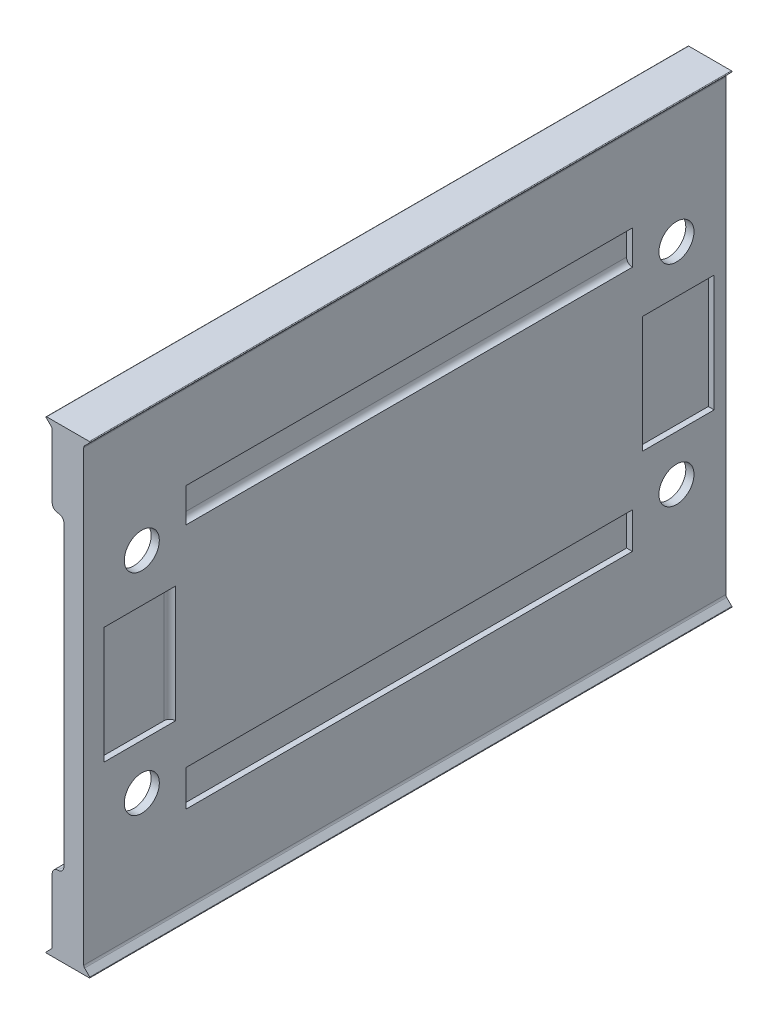
from build123d import *

# Parameters (mm, degrees)
BOSS_EXTRUDE1_DEPTH = 55
SKETCH2_R           = 2.5
SKETCH2_W           = 40
SKETCH2_H           = 18
CUT_EXTRUDE4_DEPTH  = 0.5
SKETCH7_R           = 1.5
CUT_EXTRUDE7_DEPTH  = 59.578479227
SKETCH8_R           = 3.75
CUT_EXTRUDE8_DEPTH  = 2
SKETCH9_W           = 55
SKETCH9_H           = 26.5
CUT_EXTRUDE9_DEPTH  = 1
FILLET1_R           = 0.5
FILLET2_R           = 0.5
FILLET4_R           = 0.5
FILLET5_R           = 0.5
BOSS_EXTRUDE3_START = 0.5
SKETCH10_W          = 7
SKETCH10_H          = 7
SKETCH10_R          = 1.5
BOSS_EXTRUDE3_DEPTH = 0.5


# Some blends are built 0.0001 mm under size
with BuildPart() as part:
    # Sketch1 → Boss-Extrude1 (new body)
    with BuildSketch(Plane.XY):
        with BuildLine():
            Line((-1.829289322, 19.9), (1.829289322, 19.9))
            ThreePointArc((1.829289322, 19.9), (1.875483299, 19.869134172), (1.864644661, 19.814644661))
            Line((1.864644661, 19.814644661), (1.423210766, 19.373210766))
            ThreePointArc((1.423210766, 19.373210766), (1.369017579, 19.292104929), (1.349987462, 19.196434071))
            Line((1.349987462, 19.196434071), (1.349987462, -19.196434071))
            ThreePointArc((1.349987462, -19.196434071), (1.369017579, -19.292104929), (1.423210766, -19.373210766))
            Line((1.423210766, -19.373210766), (1.864644661, -19.814644661))
            ThreePointArc((1.864644661, -19.814644661), (1.875483299, -19.869134172), (1.829289322, -19.9))
            Line((1.829289322, -19.9), (-1.829289322, -19.9))
            ThreePointArc((-1.829289322, -19.9), (-1.875483299, -19.869134172), (-1.864644661, -19.814644661))
            Line((-1.864644661, -19.814644661), (-1.423210766, -19.373210766))
            ThreePointArc((-1.423210766, -19.373210766), (-1.3697009, -19.293738232), (-1.350012538, -19.199974923))
            Line((-1.350012538, -19.199974923), (-1.350012538, 19.192893219))
            ThreePointArc((-1.350012538, 19.192893219), (-1.368345841, 19.290466829), (-1.423210766, 19.373210766))
            Line((-1.423210766, 19.373210766), (-1.864644661, 19.814644661))
            ThreePointArc((-1.864644661, 19.814644661), (-1.875483299, 19.869134172), (-1.829289322, 19.9))
        make_face()
    extrude(amount=BOSS_EXTRUDE1_DEPTH)

    # Sketch2 → Cut-Extrude4 (cut)
    with BuildSketch(Plane(origin=(1.349987462, 0, 0), x_dir=(0, 0, -1), z_dir=(1, 0, 0))):
        with BuildLine():
            Line((-51.25, 12), (-3, 12))
            ThreePointArc((-3, 12), (-1.585786438, 11.414213562), (-1, 10))
            Line((-1, 10), (-1, -10))
            ThreePointArc((-1, -10), (-1.585786438, -11.414213562), (-3, -12))
            Line((-3, -12), (-51.25, -12))
            ThreePointArc((-51.25, -12), (-52.664213562, -11.414213562), (-53.25, -10))
            Line((-53.25, -10), (-53.25, 10))
            ThreePointArc((-53.25, 10), (-52.664213562, 11.414213562), (-51.25, 12))
        make_face()
        with Locations(Location((-50.025, 9.087908505, 0), (0, 0, 90))):
            Circle(SKETCH2_R, mode=Mode.SUBTRACT)
        with Locations(Location((-50.025, -8.912091495, 0), (0, 0, 90))):
            Circle(SKETCH2_R, mode=Mode.SUBTRACT)
        with Locations(Location((-4.225, -8.912091495, 0), (0, 0, 90))):
            Circle(SKETCH2_R, mode=Mode.SUBTRACT)
        with Locations(Location((-4.225, 9.087908505, 0), (0, 0, 90))):
            Circle(SKETCH2_R, mode=Mode.SUBTRACT)
        with Locations((-27.125, 0.087908505)):
            Rectangle(SKETCH2_W, SKETCH2_H, mode=Mode.SUBTRACT)
    extrude(amount=-CUT_EXTRUDE4_DEPTH, mode=Mode.SUBTRACT)

    # Sketch7 → Cut-Extrude7 (cut, through all)
    with BuildSketch(Plane(origin=(1.349987462, 0, 0), x_dir=(0, 0, -1), z_dir=(1, 0, 0))):
        with Locations((-50.025, 9.087908505)):
            Circle(SKETCH7_R)
        with Locations((-4.225, 9.087908505)):
            Circle(SKETCH7_R)
        with Locations((-4.225, -8.912091495)):
            Circle(SKETCH7_R)
        with Locations((-50.025, -8.912091495)):
            Circle(SKETCH7_R)
    extrude(amount=-CUT_EXTRUDE7_DEPTH, mode=Mode.SUBTRACT)

    # Sketch8 → Cut-Extrude8 (cut)
    with BuildSketch(Plane.ZY.offset(1.350012538)):
        with Locations(Location((4.225, 9.087908505, 0), (0, 0, 270))):
            Circle(SKETCH8_R)
        with Locations(Location((4.225, -8.912091495, 0), (0, 0, 270))):
            Circle(SKETCH8_R)
        with Locations(Location((50.025, 9.087908505, 0), (0, 0, 270))):
            Circle(SKETCH8_R)
        with Locations(Location((50.025, -8.912091495, 0), (0, 0, 270))):
            Circle(SKETCH8_R)
    extrude(amount=-CUT_EXTRUDE8_DEPTH, mode=Mode.SUBTRACT)

    # Sketch9 → Cut-Extrude9 (cut)
    with BuildSketch(Plane.ZY.offset(1.350012538)):
        with Locations((27.5, 0)):
            Rectangle(SKETCH9_W, SKETCH9_H)
    extrude(amount=-CUT_EXTRUDE9_DEPTH, mode=Mode.SUBTRACT)

    # Fillet1
    fillet1_edges = [part.edges().sort_by_distance(p)[0] for p in [
        (-0.350012538, 13.25, 27.5),
        (-0.350012538, -13.25, 27.5),
    ]]
    fillet(fillet1_edges, radius=FILLET1_R)

    # Fillet2
    fillet2_edges = [part.edges().sort_by_distance(p)[0] for p in [
        (-1.350012538, -13.25, 27.5),
        (-1.350012538, 13.25, 27.5),
    ]]
    fillet(fillet2_edges, radius=FILLET2_R - 0.0001)  # a hair under: the kernel refuses the full size

    # Fillet4
    # the kernel refuses this fillet: 0.5 mm, written as the material it adds along each edge
    with BuildSketch(Plane(origin=(0.849987462, 9.087908505, 7.125), x_dir=(0, 0, -1), z_dir=(0, -1, 0)), Plane(origin=(0.849987462, -8.912091495, 47.125), x_dir=(0, 0, 1), z_dir=(0, 1, 0))) as fillet4_piece_1:
        with BuildLine():
            CenterArc((FILLET4_R, FILLET4_R), FILLET4_R, 180, 90)
            Line((0, FILLET4_R), (-FILLET4_R * 0.02, FILLET4_R))
            Line((-FILLET4_R * 0.02, FILLET4_R), (-FILLET4_R * 0.02, -FILLET4_R * 0.02))
            Line((-FILLET4_R * 0.02, -FILLET4_R * 0.02), (FILLET4_R, -FILLET4_R * 0.02))
            Line((FILLET4_R, -FILLET4_R * 0.02), (FILLET4_R, 0))
        make_face()
    extrude(amount=18)
    with BuildSketch(Plane(origin=(0.849987462, -8.912091495, 7.125), x_dir=(0, -1, 0), z_dir=(0, 0, 1)), Plane(origin=(0.849987462, 9.087908505, 47.125), x_dir=(0, 1, 0), z_dir=(0, 0, -1))) as fillet4_piece_2:
        with BuildLine():
            CenterArc((FILLET4_R, FILLET4_R), FILLET4_R, 180, 90)
            Line((0, FILLET4_R), (-FILLET4_R * 0.02, FILLET4_R))
            Line((-FILLET4_R * 0.02, FILLET4_R), (-FILLET4_R * 0.02, -FILLET4_R * 0.02))
            Line((-FILLET4_R * 0.02, -FILLET4_R * 0.02), (FILLET4_R, -FILLET4_R * 0.02))
            Line((FILLET4_R, -FILLET4_R * 0.02), (FILLET4_R, 0))
        make_face()
    extrude(amount=40)
    with BuildSketch(Plane(origin=(0.849987462, 10.337908505, 7.125), x_dir=(0, 0, -1), z_dir=(0, -1, 0))) as fillet4_piece_3a_section:
        with BuildLine():
            CenterArc((FILLET4_R, FILLET4_R), FILLET4_R, 180, 90)
            Line((0, FILLET4_R), (-FILLET4_R * 0.02, FILLET4_R))
            Line((-FILLET4_R * 0.02, FILLET4_R), (-FILLET4_R * 0.02, -FILLET4_R * 0.02))
            Line((-FILLET4_R * 0.02, -FILLET4_R * 0.02), (FILLET4_R, -FILLET4_R * 0.02))
            Line((FILLET4_R, -FILLET4_R * 0.02), (FILLET4_R, 0))
        make_face()
    fillet4_piece_3a = extrude(amount=19.25, mode=Mode.PRIVATE)
    fillet4_piece_3a = split(fillet4_piece_3a, bisect_by=Plane(origin=(0.963185019, 9.087908505, 7.011802443), z_dir=(0, 1, 0)), keep=Keep.TOP, mode=Mode.PRIVATE)
    with BuildSketch(Plane(origin=(0.849987462, 9.087908505, 47.125), x_dir=(0, 1, 0), z_dir=(0, 0, -1))) as fillet4_piece_3b_section:
        with BuildLine():
            CenterArc((FILLET4_R, FILLET4_R), FILLET4_R, 180, 90)
            Line((0, FILLET4_R), (-FILLET4_R * 0.02, FILLET4_R))
            Line((-FILLET4_R * 0.02, FILLET4_R), (-FILLET4_R * 0.02, -FILLET4_R * 0.02))
            Line((-FILLET4_R * 0.02, -FILLET4_R * 0.02), (FILLET4_R, -FILLET4_R * 0.02))
            Line((FILLET4_R, -FILLET4_R * 0.02), (FILLET4_R, 0))
        make_face()
    fillet4_piece_3b = extrude(amount=41.25, mode=Mode.PRIVATE)
    fillet4_piece_3b = split(fillet4_piece_3b, bisect_by=Plane(origin=(0.963185019, 9.201106062, 7.125), z_dir=(0, 0, -1)), keep=Keep.TOP, mode=Mode.PRIVATE)
    fillet4_piece_3 = fillet4_piece_3a & fillet4_piece_3b
    add(fillet4_piece_3)
    with BuildSketch(Plane(origin=(0.849987462, -8.912091495, 5.875), x_dir=(0, -1, 0), z_dir=(0, 0, 1))) as fillet4_piece_4a_section:
        with BuildLine():
            CenterArc((FILLET4_R, FILLET4_R), FILLET4_R, 180, 90)
            Line((0, FILLET4_R), (-FILLET4_R * 0.02, FILLET4_R))
            Line((-FILLET4_R * 0.02, FILLET4_R), (-FILLET4_R * 0.02, -FILLET4_R * 0.02))
            Line((-FILLET4_R * 0.02, -FILLET4_R * 0.02), (FILLET4_R, -FILLET4_R * 0.02))
            Line((FILLET4_R, -FILLET4_R * 0.02), (FILLET4_R, 0))
        make_face()
    fillet4_piece_4a = extrude(amount=41.25, mode=Mode.PRIVATE)
    fillet4_piece_4a = split(fillet4_piece_4a, bisect_by=Plane(origin=(0.963185019, -9.025289052, 7.125), z_dir=(0, 0, -1)), keep=Keep.TOP, mode=Mode.PRIVATE)
    with BuildSketch(Plane(origin=(0.849987462, 9.087908505, 7.125), x_dir=(0, 0, -1), z_dir=(0, -1, 0))) as fillet4_piece_4b_section:
        with BuildLine():
            CenterArc((FILLET4_R, FILLET4_R), FILLET4_R, 180, 90)
            Line((0, FILLET4_R), (-FILLET4_R * 0.02, FILLET4_R))
            Line((-FILLET4_R * 0.02, FILLET4_R), (-FILLET4_R * 0.02, -FILLET4_R * 0.02))
            Line((-FILLET4_R * 0.02, -FILLET4_R * 0.02), (FILLET4_R, -FILLET4_R * 0.02))
            Line((FILLET4_R, -FILLET4_R * 0.02), (FILLET4_R, 0))
        make_face()
    fillet4_piece_4b = extrude(amount=19.25, mode=Mode.PRIVATE)
    fillet4_piece_4b = split(fillet4_piece_4b, bisect_by=Plane(origin=(0.963185019, -8.912091495, 7.011802443), z_dir=(0, -1, 0)), keep=Keep.TOP, mode=Mode.PRIVATE)
    fillet4_piece_4 = fillet4_piece_4a & fillet4_piece_4b
    add(fillet4_piece_4)
    with BuildSketch(Plane(origin=(0.849987462, -10.162091495, 47.125), x_dir=(0, 0, 1), z_dir=(0, 1, 0))) as fillet4_piece_5a_section:
        with BuildLine():
            CenterArc((FILLET4_R, FILLET4_R), FILLET4_R, 180, 90)
            Line((0, FILLET4_R), (-FILLET4_R * 0.02, FILLET4_R))
            Line((-FILLET4_R * 0.02, FILLET4_R), (-FILLET4_R * 0.02, -FILLET4_R * 0.02))
            Line((-FILLET4_R * 0.02, -FILLET4_R * 0.02), (FILLET4_R, -FILLET4_R * 0.02))
            Line((FILLET4_R, -FILLET4_R * 0.02), (FILLET4_R, 0))
        make_face()
    fillet4_piece_5a = extrude(amount=19.25, mode=Mode.PRIVATE)
    fillet4_piece_5a = split(fillet4_piece_5a, bisect_by=Plane(origin=(0.963185019, -8.912091495, 47.238197557), z_dir=(0, -1, 0)), keep=Keep.TOP, mode=Mode.PRIVATE)
    with BuildSketch(Plane(origin=(0.849987462, -8.912091495, 7.125), x_dir=(0, -1, 0), z_dir=(0, 0, 1))) as fillet4_piece_5b_section:
        with BuildLine():
            CenterArc((FILLET4_R, FILLET4_R), FILLET4_R, 180, 90)
            Line((0, FILLET4_R), (-FILLET4_R * 0.02, FILLET4_R))
            Line((-FILLET4_R * 0.02, FILLET4_R), (-FILLET4_R * 0.02, -FILLET4_R * 0.02))
            Line((-FILLET4_R * 0.02, -FILLET4_R * 0.02), (FILLET4_R, -FILLET4_R * 0.02))
            Line((FILLET4_R, -FILLET4_R * 0.02), (FILLET4_R, 0))
        make_face()
    fillet4_piece_5b = extrude(amount=41.25, mode=Mode.PRIVATE)
    fillet4_piece_5b = split(fillet4_piece_5b, bisect_by=Plane(origin=(0.963185019, -9.025289052, 47.125), z_dir=(0, 0, 1)), keep=Keep.TOP, mode=Mode.PRIVATE)
    fillet4_piece_5 = fillet4_piece_5a & fillet4_piece_5b
    add(fillet4_piece_5)
    with BuildSketch(Plane(origin=(0.849987462, -8.912091495, 47.125), x_dir=(0, 0, 1), z_dir=(0, 1, 0))) as fillet4_piece_6a_section:
        with BuildLine():
            CenterArc((FILLET4_R, FILLET4_R), FILLET4_R, 180, 90)
            Line((0, FILLET4_R), (-FILLET4_R * 0.02, FILLET4_R))
            Line((-FILLET4_R * 0.02, FILLET4_R), (-FILLET4_R * 0.02, -FILLET4_R * 0.02))
            Line((-FILLET4_R * 0.02, -FILLET4_R * 0.02), (FILLET4_R, -FILLET4_R * 0.02))
            Line((FILLET4_R, -FILLET4_R * 0.02), (FILLET4_R, 0))
        make_face()
    fillet4_piece_6a = extrude(amount=19.25, mode=Mode.PRIVATE)
    fillet4_piece_6a = split(fillet4_piece_6a, bisect_by=Plane(origin=(0.963185019, 9.087908505, 47.238197557), z_dir=(0, 1, 0)), keep=Keep.TOP, mode=Mode.PRIVATE)
    with BuildSketch(Plane(origin=(0.849987462, 9.087908505, 48.375), x_dir=(0, 1, 0), z_dir=(0, 0, -1))) as fillet4_piece_6b_section:
        with BuildLine():
            CenterArc((FILLET4_R, FILLET4_R), FILLET4_R, 180, 90)
            Line((0, FILLET4_R), (-FILLET4_R * 0.02, FILLET4_R))
            Line((-FILLET4_R * 0.02, FILLET4_R), (-FILLET4_R * 0.02, -FILLET4_R * 0.02))
            Line((-FILLET4_R * 0.02, -FILLET4_R * 0.02), (FILLET4_R, -FILLET4_R * 0.02))
            Line((FILLET4_R, -FILLET4_R * 0.02), (FILLET4_R, 0))
        make_face()
    fillet4_piece_6b = extrude(amount=41.25, mode=Mode.PRIVATE)
    fillet4_piece_6b = split(fillet4_piece_6b, bisect_by=Plane(origin=(0.963185019, 9.201106062, 47.125), z_dir=(0, 0, 1)), keep=Keep.TOP, mode=Mode.PRIVATE)
    fillet4_piece_6 = fillet4_piece_6a & fillet4_piece_6b
    add(fillet4_piece_6)

    # Fillet5
    fillet5_edges = [part.edges().sort_by_distance(p)[0] for p in [
        (0.649987462, -5.162091495, 4.225),
        (0.649987462, 12.837908505, 50.025),
        (0.649987462, -5.162091495, 50.025),
        (0.649987462, 12.837908505, 4.225),
    ]]
    fillet(fillet5_edges, radius=FILLET5_R)

    # Sketch10 → Boss-Extrude3 (add)
    # profile 1 of 4: a face of its own
    with BuildSketch(Plane(origin=(0.849987462, 0, 0), x_dir=(0, 0, -1), z_dir=(1, 0, 0)).offset(BOSS_EXTRUDE3_START)):
        with Locations((-4.5, 8.5)):
            Rectangle(SKETCH10_W, SKETCH10_H)
        with Locations((-4.225, 9.087908505)):
            Circle(SKETCH10_R, mode=Mode.SUBTRACT)
    # profile 2 of 4: a face of its own
    with BuildSketch(Plane(origin=(0.849987462, 0, 0), x_dir=(0, 0, -1), z_dir=(1, 0, 0)).offset(BOSS_EXTRUDE3_START)):
        with Locations((-49.75, -8.5)):
            Rectangle(SKETCH10_W, SKETCH10_H)
        with Locations((-50.025, -8.912091495)):
            Circle(SKETCH10_R, mode=Mode.SUBTRACT)
    # profile 3 of 4: a face of its own
    with BuildSketch(Plane(origin=(0.849987462, 0, 0), x_dir=(0, 0, -1), z_dir=(1, 0, 0)).offset(BOSS_EXTRUDE3_START)):
        with Locations((-4.5, -8.5)):
            Rectangle(SKETCH10_W, SKETCH10_H)
        with Locations((-4.225, -8.912091495)):
            Circle(SKETCH10_R, mode=Mode.SUBTRACT)
    # profile 4 of 4: a face of its own
    with BuildSketch(Plane(origin=(0.849987462, 0, 0), x_dir=(0, 0, -1), z_dir=(1, 0, 0)).offset(BOSS_EXTRUDE3_START)):
        with Locations((-49.75, 8.5)):
            Rectangle(SKETCH10_W, SKETCH10_H)
        with Locations((-50.025, 9.087908505)):
            Circle(SKETCH10_R, mode=Mode.SUBTRACT)
    extrude(amount=-BOSS_EXTRUDE3_DEPTH)


solid = part.part
